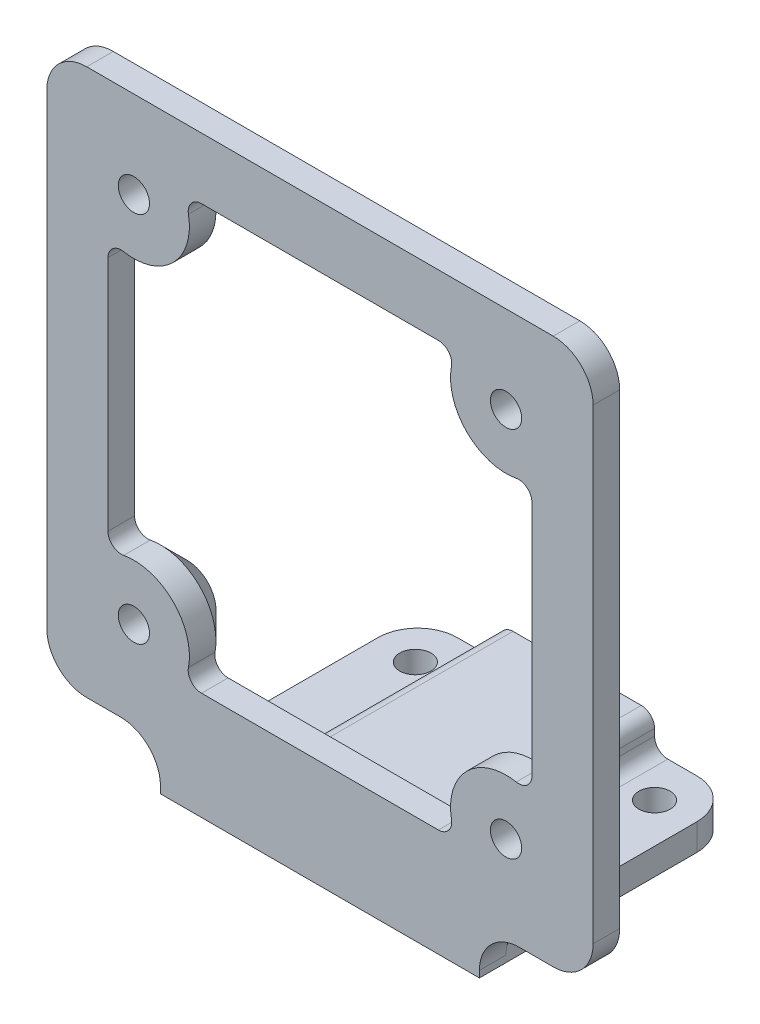
from build123d import *

# Parameters (mm, degrees)
SKETCH3_R           = 1.175
BOSS_EXTRUDE1_DEPTH = 2
FILLET1_R           = 3
SKETCH4_W           = 24
SKETCH4_H           = 19.35
SKETCH4_R           = 1.175
BOSS_EXTRUDE2_DEPTH = 2
FILLET2_R           = 3
SKETCH5_R           = 2.175
SKETCH5_R_2         = 1.175
BOSS_EXTRUDE3_DEPTH = 2
CHAMFER2_SIZE       = 2
CUT_EXTRUDE1_REACH  = 54.781
FILLET3_R           = 1
SKETCH7_W           = 11.65
SKETCH7_H           = 2.5
BOSS_EXTRUDE4_DEPTH = 17.35
FILLET4_R           = 1
CHAMFER3_SIZE       = 1


with BuildPart() as part:
    # Sketch3 → Boss-Extrude1 (new body)
    with BuildSketch(Plane.XY):
        Polygon((-20.55, 3.5), (-12, 3.5), (-12, 0), (12, 0), (12, 3.5), (20.55, 3.5), (20.55, 44.6), (-20.55, 44.6), align=None)
        with Locations((14, 38.05)):
            Circle(SKETCH3_R, mode=Mode.SUBTRACT)
        with Locations((-14, 38.05)):
            Circle(SKETCH3_R, mode=Mode.SUBTRACT)
        with Locations((-14, 10.05)):
            Circle(SKETCH3_R, mode=Mode.SUBTRACT)
        with Locations((14, 10.05)):
            Circle(SKETCH3_R, mode=Mode.SUBTRACT)
    extrude(amount=-BOSS_EXTRUDE1_DEPTH)

    # Fillet1
    fillet1_edges = [part.edges().sort_by_distance(p)[0] for p in [
        (12, 3.5, -1),
        (-12, 3.5, -1),
    ]]
    fillet(fillet1_edges, radius=FILLET1_R)

    # Sketch4 → Boss-Extrude2 (add)
    with BuildSketch(Plane.XZ):
        with Locations((0, -9.675)):
            Rectangle(SKETCH4_W, SKETCH4_H)
        with Locations(Location((9, -16.175, 0), (0, 0, 270))):
            Circle(SKETCH4_R, mode=Mode.SUBTRACT)
        with Locations(Location((-9, -16.175, 0), (0, 0, 270))):
            Circle(SKETCH4_R, mode=Mode.SUBTRACT)
        with Locations(Location((-9, -5.175, 0), (0, 0, 270))):
            Circle(SKETCH4_R, mode=Mode.SUBTRACT)
        with Locations(Location((9, -5.175, 0), (0, 0, 270))):
            Circle(SKETCH4_R, mode=Mode.SUBTRACT)
    extrude(amount=-BOSS_EXTRUDE2_DEPTH)

    # Fillet2
    fillet2_edges = [part.edges().sort_by_distance(p)[0] for p in [
        (-20.55, 44.6, -1),
        (20.55, 44.6, -1),
        (20.55, 3.5, -1),
        (-20.55, 3.5, -1),
        (-12, 1, -19.35),
        (12, 1, -19.35),
    ]]
    fillet(fillet2_edges, radius=FILLET2_R)

    # Sketch5 → Boss-Extrude3 (add)
    # profile 1 of 4: a face of its own
    with BuildSketch(Plane(origin=(0, 0, -2), x_dir=(-1, 0, 0), z_dir=(0, 0, -1))):
        with Locations(Location((14, 10.05, 0), (0, 0, 180))):
            Circle(SKETCH5_R)
        with Locations(Location((14, 10.05, 0), (0, 0, 180))):
            Circle(SKETCH5_R_2, mode=Mode.SUBTRACT)
    # profile 2 of 4: a face of its own
    with BuildSketch(Plane(origin=(0, 0, -2), x_dir=(-1, 0, 0), z_dir=(0, 0, -1))):
        with Locations(Location((-14, 10.05, 0), (0, 0, 180))):
            Circle(SKETCH5_R)
        with Locations(Location((-14, 10.05, 0), (0, 0, 180))):
            Circle(SKETCH5_R_2, mode=Mode.SUBTRACT)
    # profile 3 of 4: a face of its own
    with BuildSketch(Plane(origin=(0, 0, -2), x_dir=(-1, 0, 0), z_dir=(0, 0, -1))):
        with Locations(Location((-14, 38.05, 0), (0, 0, 180))):
            Circle(SKETCH5_R)
        with Locations(Location((-14, 38.05, 0), (0, 0, 180))):
            Circle(SKETCH5_R_2, mode=Mode.SUBTRACT)
    # profile 4 of 4: a face of its own
    with BuildSketch(Plane(origin=(0, 0, -2), x_dir=(-1, 0, 0), z_dir=(0, 0, -1))):
        with Locations(Location((14, 38.05, 0), (0, 0, 180))):
            Circle(SKETCH5_R)
        with Locations(Location((14, 38.05, 0), (0, 0, 180))):
            Circle(SKETCH5_R_2, mode=Mode.SUBTRACT)
    extrude(amount=BOSS_EXTRUDE3_DEPTH)

    # Chamfer2
    chamfer2_edges = [part.edges().sort_by_distance(p)[0] for p in [
        (-16.175, 10.05, -2),
        (11.825, 10.05, -2),
        (11.825, 38.05, -2),
        (-16.175, 38.05, -2),
    ]]
    chamfer(chamfer2_edges, length=CHAMFER2_SIZE - 0.0001)  # a hair under: the kernel refuses the full size

    # Sketch6 → Cut-Extrude1 (cut, up to next)
    with BuildSketch(Plane.XY, mode=Mode.PRIVATE) as cut_extrude1_sk1:
        with BuildLine():
            Line((-10.308370956, 40), (10.308370956, 40))
            ThreePointArc((10.308370956, 40), (11.047829189, 35.097829189), (15.95, 34.358370956))
            Line((15.95, 34.358370956), (15.95, 13.741629044))
            ThreePointArc((15.95, 13.741629044), (11.047829189, 13.002170811), (10.308370956, 8.1))
            Line((10.308370956, 8.1), (-10.308370956, 8.1))
            ThreePointArc((-10.308370956, 8.1), (-11.047829189, 13.002170811), (-15.95, 13.741629044))
            Line((-15.95, 13.741629044), (-15.95, 34.358370956))
            ThreePointArc((-15.95, 34.358370956), (-11.047829189, 35.097829189), (-10.308370956, 40))
        make_face()
    cut_extrude1_tool1 = extrude(cut_extrude1_sk1.sketch, amount=-CUT_EXTRUDE1_REACH, mode=Mode.PRIVATE) & part.part
    add(cut_extrude1_tool1.solids().sort_by_distance((0, 24.05, 0))[0], mode=Mode.SUBTRACT)

    # Fillet3
    fillet3_edges = [part.edges().sort_by_distance(p)[0] for p in [
        (-10.308370956, 8.1, -1),
        (-15.95, 13.741629044, -1),
        (-15.95, 34.358370956, -1),
        (-10.308370956, 40, -1),
        (10.308370956, 40, -1),
        (15.95, 34.358370956, -1),
        (15.95, 13.741629044, -1),
        (10.308370956, 8.1, -1),
    ]]
    fillet(fillet3_edges, radius=FILLET3_R)

    # Sketch7 → Boss-Extrude4 (add, through all)
    with BuildSketch(Plane(origin=(0, 0, -2), x_dir=(-1, 0, 0), z_dir=(0, 0, -1))):
        with Locations((0, 3.25)):
            Rectangle(SKETCH7_W, SKETCH7_H)
    extrude(amount=BOSS_EXTRUDE4_DEPTH)

    # Fillet4
    fillet4_edges = [part.edges().sort_by_distance(p)[0] for p in [
        (5.825, 4.5, -10.675),
        (5.825, 2, -10.675),
        (-5.825, 2, -10.675),
        (-5.825, 4.5, -10.675),
    ]]
    fillet(fillet4_edges, radius=FILLET4_R)

    # Chamfer3
    chamfer3_edges = [part.edges().sort_by_distance(p)[0] for p in [
        (-5.825, 3.25, -2),
        (5.825, 3.25, -2),
        (0, 4.5, -2),
        (9.4125, 2, -2),
        (6.117893219, 2.292893219, -2),
        (-6.117893219, 2.292893219, -2),
        (-5.532106781, 4.207106781, -2),
        (5.532106781, 4.207106781, -2),
        (-9.4125, 2, -2),
    ]]
    chamfer(chamfer3_edges, length=CHAMFER3_SIZE - 0.0001)  # a hair under: the kernel refuses the full size


solid = part.part
